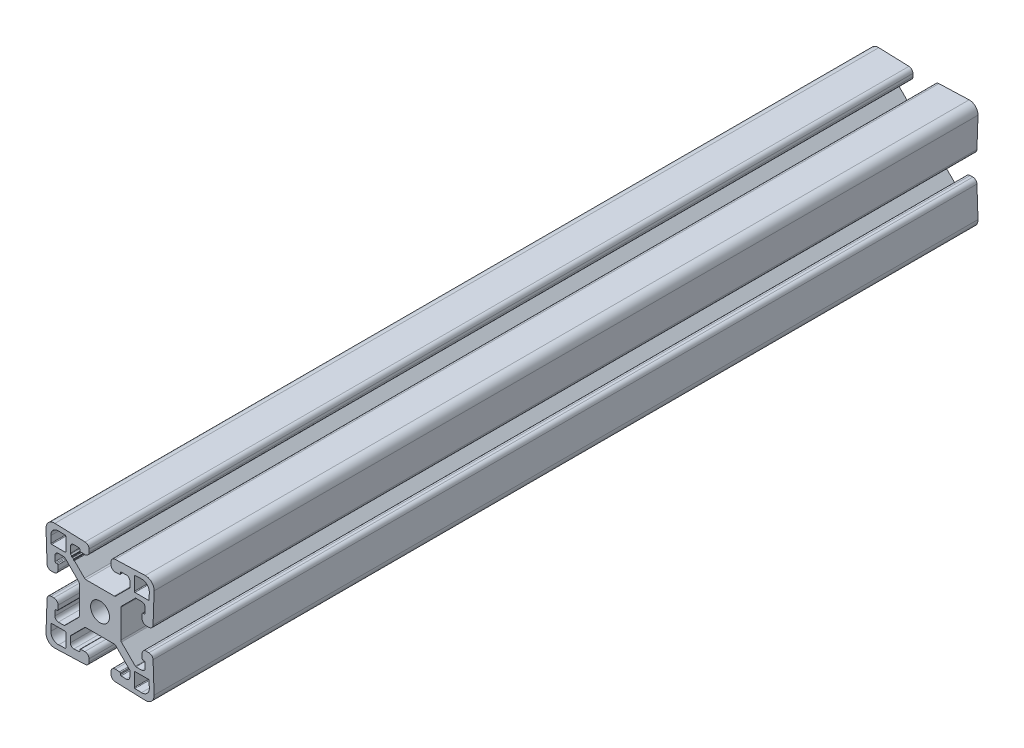
from build123d import *

# Parameters (mm, degrees)
BOSS_EXTRUDE1_DEPTH     = 152.4
CIRPATTERN1_COUNT       = 4
CUT_EXTRUDE1_DEPTH      = 156.002451594
CUT_EXTRUDE1_DEPTH_BACK = 156.002451594


with BuildPart() as part:
    # Sketch3 → Boss-Extrude1 (new, symmetric)
    with BuildSketch(Plane.XY):
        with BuildLine():
            Line((-7.681, 0), (-7.681, 5.210107796))
            ThreePointArc((-7.681, 5.210107796), (-7.739003796, 5.501712572), (-7.904184633, 5.748923164))
            Line((-7.904184633, 5.748923164), (-13.062267872, 10.907006403))
            ThreePointArc((-13.062267872, 10.907006403), (-13.165272285, 10.975831752), (-13.286774275, 11))
            Line((-13.286774275, 11), (-15.433540431, 11))
            ThreePointArc((-15.433540431, 11), (-16.347101978, 10.61221613), (-16.702766782, 9.685677639))
            Line((-16.702766782, 9.685677639), (-16.637141638, 7.80641941))
            ThreePointArc((-16.637141638, 7.80641941), (-16.540389083, 7.589109613), (-16.319835051, 7.5))
            Line((-16.319835051, 7.5), (-15.916428126, 7.5))
            ThreePointArc((-15.916428126, 7.5), (-15.695874093, 7.410890387), (-15.599121538, 7.19358059))
            Line((-15.599121538, 7.19358059), (-15.544946893, 5.642221732))
            ThreePointArc((-15.544946893, 5.642221732), (-15.972024709, 4.529645985), (-17.069017904, 4.064))
            Line((-17.069017904, 4.064), (-18.083635982, 4.064))
            ThreePointArc((-18.083635982, 4.064), (-19.142989997, 4.492006804), (-19.607706993, 5.535778268))
            Line((-19.607706993, 5.535778268), (-19.998065876, 16.714194098))
            ThreePointArc((-19.998065876, 16.714194098), (-19.07006403, 19.07006403), (-16.714194098, 19.998065876))
            Line((-16.714194098, 19.998065876), (-5.535778268, 19.607706993))
            ThreePointArc((-5.535778268, 19.607706993), (-4.492006804, 19.142989997), (-4.064, 18.083635982))
            Line((-4.064, 18.083635982), (-4.064, 17.069017904))
            ThreePointArc((-4.064, 17.069017904), (-4.529645985, 15.972024709), (-5.642221732, 15.544946893))
            Line((-5.642221732, 15.544946893), (-7.19358059, 15.599121538))
            ThreePointArc((-7.19358059, 15.599121538), (-7.410890387, 15.695874093), (-7.5, 15.916428126))
            Line((-7.5, 15.916428126), (-7.5, 16.319835051))
            ThreePointArc((-7.5, 16.319835051), (-7.589109613, 16.540389083), (-7.80641941, 16.637141638))
            Line((-7.80641941, 16.637141638), (-9.685677639, 16.702766782))
            ThreePointArc((-9.685677639, 16.702766782), (-10.61221613, 16.347101978), (-11, 15.433540431))
            Line((-11, 15.433540431), (-11, 13.286774275))
            ThreePointArc((-11, 13.286774275), (-10.975831752, 13.165272285), (-10.907006403, 13.062267872))
            Line((-10.907006403, 13.062267872), (-5.748923164, 7.904184633))
            ThreePointArc((-5.748923164, 7.904184633), (-5.501712572, 7.739003796), (-5.210107796, 7.681))
            Line((-5.210107796, 7.681), (0, 7.681))
            Line((0, 7.681), (0, 3.5))
            ThreePointArc((0, 3.5), (-2.474873734, 2.474873734), (-3.5, 0))
            Line((-3.5, 0), (-7.681, 0))
        make_face()
        with BuildLine():
            Line((-18.220706879, 15.330899714), (-18.136032248, 12.906135528))
            ThreePointArc((-18.136032248, 12.906135528), (-18.058630204, 12.732287691), (-17.882186978, 12.661))
            Line((-17.882186978, 12.661), (-12.915, 12.661))
            ThreePointArc((-12.915, 12.661), (-12.735394878, 12.735394878), (-12.661, 12.915))
            Line((-12.661, 12.915), (-12.661, 17.882186978))
            ThreePointArc((-12.661, 17.882186978), (-12.732287691, 18.058630204), (-12.906135528, 18.136032248))
            Line((-12.906135528, 18.136032248), (-15.330899714, 18.220706879))
            ThreePointArc((-15.330899714, 18.220706879), (-17.404065255, 17.404065255), (-18.220706879, 15.330899714))
        make_face(mode=Mode.SUBTRACT)
    boss_extrude1 = extrude(amount=BOSS_EXTRUDE1_DEPTH, both=True)

    # CirPattern1: Boss-Extrude1 ×4 about axis
    cirpattern1_axis = Axis((0, 0, 152.4), (0, 0, -1))
    for i in range(1, CIRPATTERN1_COUNT):
        add(boss_extrude1.rotate(cirpattern1_axis, i * 360 / CIRPATTERN1_COUNT))

    # Sketch4 → Cut-Extrude1 (cut, two sides: drawn at the far end of the back side and taken through both)
    with BuildSketch(Plane.XY.offset(-CUT_EXTRUDE1_DEPTH_BACK)):
        Polygon((-10.505738531, 12.661), (-9.505738531, 12.661), (-9.505738531, 11.661), (-9.839071864, 11.661), (-9.839071864, 11.994333333), (-10.172405198, 12.327666667), (-10.505738531, 12.327666667), align=None)
    extrude(amount=CUT_EXTRUDE1_DEPTH + CUT_EXTRUDE1_DEPTH_BACK, mode=Mode.SUBTRACT)


solid = part.part
